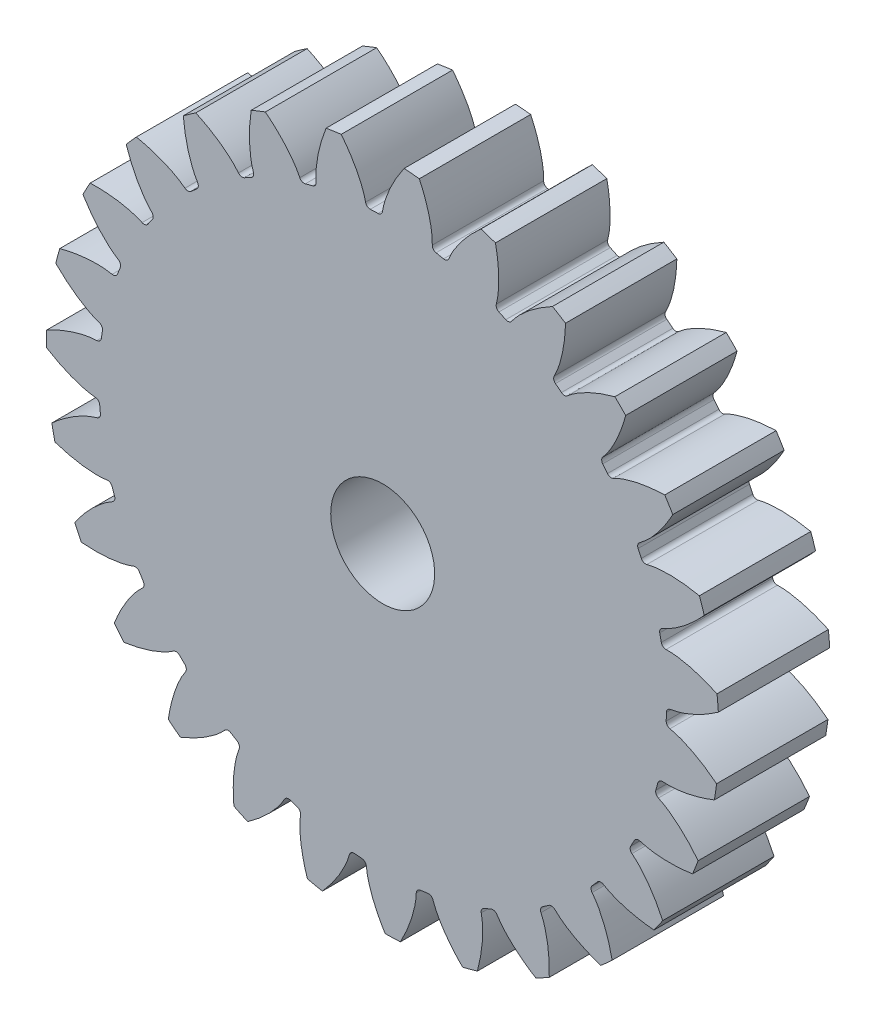
from build123d import *

# Parameters (mm, degrees)
SKETCH2_R                = 18.125
BOSS_EXTRUDE1_DEPTH      = 6
CUT_EXTRUDE1_DEPTH       = 6
FILLET1_R                = 0.254
CIRPATTERN3_COUNT        = 27
FILLET1_OF_CIRPATTERN3_R = 0.254
SKETCH3_R                = 2.8
CUT_EXTRUDE2_DEPTH       = 27.324971305


# Read off the part's stored shape, not the designer's step: Cut-Extrude1
with BuildPart() as part:
    # Sketch2 → Boss-Extrude1 (new body)
    with BuildSketch(Plane.XY):
        Circle(SKETCH2_R)
    extrude(amount=BOSS_EXTRUDE1_DEPTH)

    # Cut-Extrude1 outline → Cut-Extrude1 (cut)
    with BuildSketch(Plane.XY):
        with BuildLine():
            add(Edge.make_bspline(
                [(15.293943906, 0), (15.305253299, 0), (15.336964339, 0.00074082), (15.396845119, 0.005066139), (15.494240284, 0.016267993), (15.617714722, 0.036610689), (15.776289364, 0.069834677), (15.961506744, 0.117828662), (16.163035486, 0.179773153), (16.379749283, 0.256988095), (16.59342961, 0.342624014), (16.803983292, 0.435958219), (17.011216032, 0.536009953), (17.259008351, 0.665439426), (17.551466226, 0.832023435), (17.793413557, 0.984652677), (17.98203981, 1.112094263), (18.081230118, 1.181579697), (18.086216109, 1.185078834)],
                knots=[0, 0, 0, 0, 0, 0.005376748, 0.015083688, 0.02853182, 0.046610139, 0.064854849, 0.092110525, 0.119476175, 0.146842495, 0.174208853, 0.201574955, 0.228941013, 0.256307345, 0.307035032, 0.361767351, 0.364665932, 0.364665932, 0.364665932, 0.364665932, 0.364665932], degree=4))
            Line((15.293943906, 0), (15.269621682, -0.86219134))
            add(Edge.make_bspline(
                [(17.990644834, -2.202799001), (17.985864036, -2.199024345), (17.890748691, -2.124057592), (17.709606894, -1.986184932), (17.476648761, -1.820158714), (17.194047109, -1.637352405), (16.953945405, -1.49415955), (16.752682616, -1.382584249), (16.547725468, -1.277528577), (16.339212659, -1.179982683), (16.127196474, -1.090673365), (15.929480328, -1.017466265), (15.747263149, -0.959107033), (15.590813683, -0.916996286), (15.468682422, -0.889725108), (15.372073647, -0.873050446), (15.312531935, -0.865356246), (15.280913089, -0.862828904), (15.269621682, -0.86219134)],
                knots=[0.544424984, 0.544424984, 0.544424984, 0.544424984, 0.544424984, 0.547323565, 0.602055884, 0.652783571, 0.680149903, 0.707515961, 0.734882063, 0.762248421, 0.789614741, 0.816980391, 0.844236067, 0.862480777, 0.880559096, 0.894007228, 0.903714168, 0.909090916, 0.909090916, 0.909090916, 0.909090916, 0.909090916], degree=4))
            ThreePointArc((17.990644834, -2.202799001), (18.117792441, -0.511098867), (18.086216109, 1.185078834))
        make_face()
    cut_extrude1 = extrude(amount=CUT_EXTRUDE1_DEPTH, mode=Mode.SUBTRACT)

    # Fillet1
    fillet1_edges = [part.edges().sort_by_distance(p)[0] for p in [
        (15.269621682, -0.86219134, 3),
        (15.293943906, 0, 3),
    ]]
    fillet(fillet1_edges, radius=FILLET1_R)

    # CirPattern3: Cut-Extrude1 ×27 about axis
    cirpattern3_axis = Axis((0, 0, 18.908609159), (0, 0, -1))
    for i in range(1, CIRPATTERN3_COUNT):
        add(cut_extrude1.rotate(cirpattern3_axis, i * 360 / CIRPATTERN3_COUNT), mode=Mode.SUBTRACT)

    # Fillet1 of CirPattern3
    fillet1_of_cirpattern3_edges = [part.edges().sort_by_distance(p)[0] for p in [
        (14.659192047, -4.360367961, 3),
        (14.881693669, -3.527026191, 3),
        (13.258481574, -7.623476016, 3),
        (13.667167474, -6.863909487, 3),
        (11.143002927, -10.475600507, 3),
        (11.715840743, -9.830757646, 3),
        (8.426802109, -12.762982662, 3),
        (9.132910004, -12.267627116, 3),
        (5.256310208, -14.362309119, 3),
        (6.057621724, -14.043145632, 3),
        (1.802449263, -15.187359773, 3),
        (2.655765489, -15.061594533, 3),
        (-1.748582189, -15.193655931, 3),
        (-0.889263752, -15.268068974, 3),
        (-5.205347122, -14.380858165, 3),
        (-4.386352553, -14.651437864, 3),
        (-8.381490444, -12.792784613, 3),
        (-7.646971953, -13.244943947, 3),
        (-11.105785447, -10.515048731, 3),
        (-10.495341116, -11.124411673, 3),
        (-13.231364682, -7.67044385, 3),
        (-12.777903722, -8.404159486, 3),
        (-14.643637622, -4.412323356, 3),
        (-14.371606231, -5.230836887, 3),
        (-15.266468268, -0.916333368, 3),
        (-15.190531729, -1.775518517, 3),
        (-15.066279658, 2.629056389, 3),
        (-15.190531729, 1.775518517, 3),
        (-14.053864011, 6.032713036, 3),
        (-14.371606231, 5.230836887, 3),
        (-12.283800918, 9.111144562, 3),
        (-12.777903722, 8.404159486, 3),
        (-9.851514938, 11.698391926, 3),
        (-10.495341116, 11.124411673, 3),
        (-6.888131238, 13.654975953, 3),
        (-7.646971953, 13.244943947, 3),
        (-3.553406599, 14.875416692, 3),
        (-4.386352553, 14.651437864, 3),
        (-0.027116892, 15.293919867, 3),
        (-0.889263752, 15.268068974, 3),
        (3.500634695, 14.887923863, 3),
        (2.655765489, 15.061594533, 3),
        (6.839666159, 13.67931603, 3),
        (6.057621724, 14.043145632, 3),
        (9.80996945, 11.733252729, 3),
        (9.132910004, 12.267627116, 3),
        (12.251414749, 9.154646737, 3),
        (11.715840743, 9.830757646, 3),
        (14.032383107, 6.082511369, 3),
        (13.667167474, 6.863909487, 3),
        (15.05686206, 2.682466239, 3),
        (14.881693669, 3.527026191, 3),
    ]]
    fillet(fillet1_of_cirpattern3_edges, radius=FILLET1_OF_CIRPATTERN3_R)

    # Sketch3 → Cut-Extrude2 (cut, through all)
    with BuildSketch(Plane(origin=(0, 0, 0), x_dir=(-1, 0, 0), z_dir=(0, 0, -1))):
        Circle(SKETCH3_R)
    extrude(amount=-CUT_EXTRUDE2_DEPTH, mode=Mode.SUBTRACT)


solid = part.part
